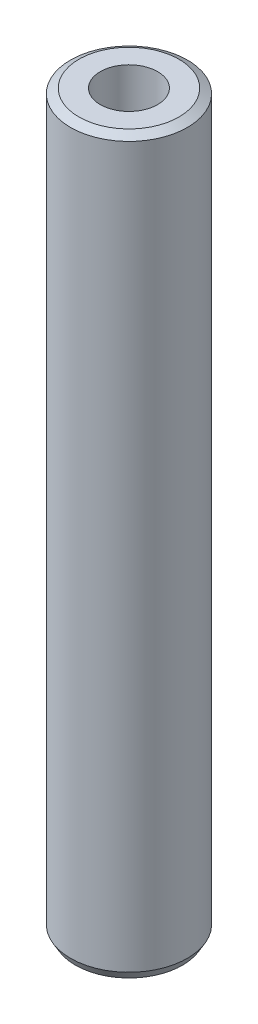
from build123d import *
from OCP.BRepFilletAPI import BRepFilletAPI_MakeChamfer

# Parameters (mm, degrees)
SKETCH1_R           = 27.5
BOSS_EXTRUDE1_DEPTH = 344.806056063
SKETCH2_R           = 13.474124689
CUT_EXTRUDE1_DEPTH  = 347.992386513
CHAMFER1_SIZE       = 2.283705422
CHAMFER1_SIZE2      = 3.955493821


with BuildPart() as part:
    # Sketch1 → Boss-Extrude1 (new body)
    with BuildSketch(Plane(origin=(0, 0, 0), x_dir=(1, 0, 0), z_dir=(0, 1, 0))):
        Circle(SKETCH1_R)
    extrude(amount=BOSS_EXTRUDE1_DEPTH)

    # Sketch2 → Cut-Extrude1 (cut, through all)
    with BuildSketch(Plane(origin=(0, 0, 0), x_dir=(1, 0, 0), z_dir=(0, 1, 0))):
        Circle(SKETCH2_R)
    extrude(amount=CUT_EXTRUDE1_DEPTH, mode=Mode.SUBTRACT)

    # Chamfer1: one chamfer whose edges measure the first distance from different faces: ONE call of the kernel's chamfer builder (chamfer() names one face for all edges)
    chamfer1_edges_1 = [part.edges().sort_by_distance(p)[0] for p in [
        (-27.5, 344.806056063, 0),
    ]]
    chamfer1_side_1 = [part.faces().sort_by_distance(p)[0] for p in [
        (-27.5, 172.403028032, 0),
    ]]
    chamfer1_edges_2 = [part.edges().sort_by_distance(p)[0] for p in [
        (-27.5, 0, 0),
    ]]
    chamfer1_side_2 = [part.faces().sort_by_distance(p)[0] for p in [
        (-26.722182541, 0, 0),
    ]]
    chamfer1 = BRepFilletAPI_MakeChamfer(part.part.solid().wrapped)
    for e in chamfer1_edges_1:
        chamfer1.Add(CHAMFER1_SIZE, CHAMFER1_SIZE2, e.wrapped, chamfer1_side_1[0].wrapped)  # the first distance lies on this face
    for e in chamfer1_edges_2:
        chamfer1.Add(CHAMFER1_SIZE, CHAMFER1_SIZE2, e.wrapped, chamfer1_side_2[0].wrapped)  # the first distance lies on this face
    add(Compound.cast(chamfer1.Shape()), mode=Mode.REPLACE)


solid = part.part
